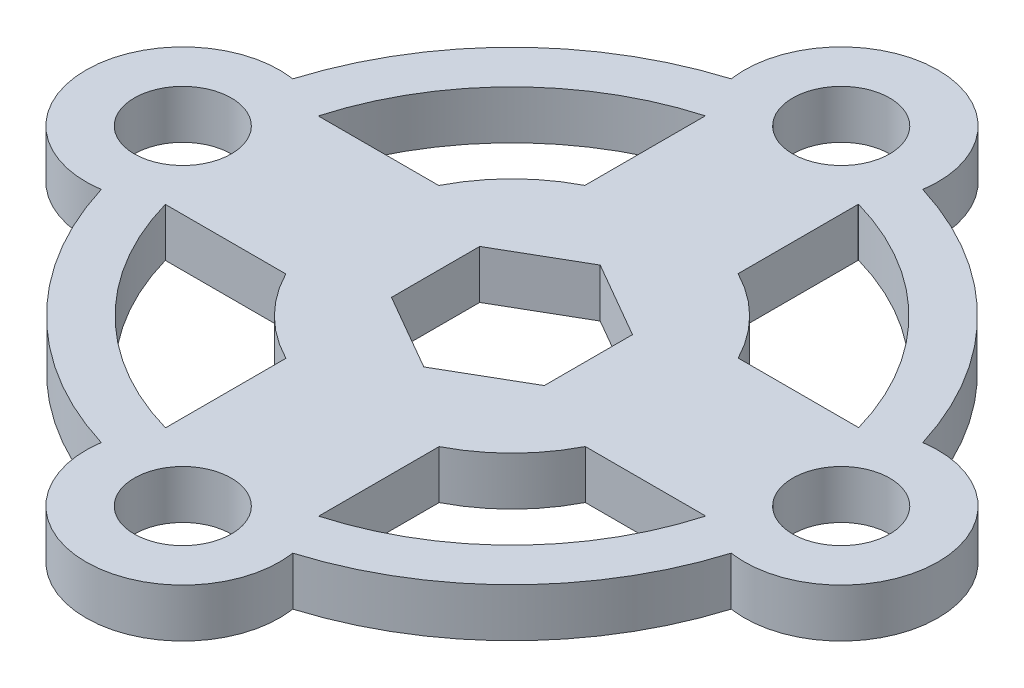
from build123d import *

# Parameters (mm, degrees)
SKETCH1_R           = 3.175
BOSS_EXTRUDE1_DEPTH = 3.175


with BuildPart() as part:
    # Sketch1 → Boss-Extrude1 (new body)
    with BuildSketch(Plane(origin=(0, 0, 0), x_dir=(1, 0, 0), z_dir=(0, 1, 0))):
        with BuildLine():
            ThreePointArc((-6.270051206, 20.615595113), (-15.236736921, 15.236736921), (-20.615595113, 6.270051206))
            ThreePointArc((-20.615595113, 6.270051206), (-27.887, 0), (-20.615595113, -6.270051206))
            ThreePointArc((-20.615595113, -6.270051206), (-15.236736921, -15.236736921), (-6.270051206, -20.615595113))
            ThreePointArc((-6.270051206, -20.615595113), (0, -27.887), (6.270051206, -20.615595113))
            ThreePointArc((6.270051206, -20.615595113), (15.236736921, -15.236736921), (20.615595113, -6.270051206))
            ThreePointArc((20.615595113, -6.270051206), (27.887, 0), (20.615595113, 6.270051206))
            ThreePointArc((20.615595113, 6.270051206), (15.236736921, 15.236736921), (6.270051206, 20.615595113))
            ThreePointArc((6.270051206, 20.615595113), (0, 27.887), (-6.270051206, 20.615595113))
        make_face()
        with BuildLine():
            Line((5, 9.797958971), (5, 17.651473213))
            ThreePointArc((5, 17.651473213), (5.008945556, 17.662979355), (5.017864634, 17.674506033))
            ThreePointArc((5.017864634, 17.674506033), (12.991672891, 12.991672891), (17.674506033, 5.017864634))
            Line((17.674506033, 5.017864634), (9.788821916, 5.017864634))
            ThreePointArc((9.788821916, 5.017864634), (7.771077074, 7.785265642), (5, 9.797958971))
        make_face(mode=Mode.SUBTRACT)
        with BuildLine():
            Line((-5.017864634, 17.674506033), (-5.017864634, 9.788821916))
            ThreePointArc((-5.017864634, 9.788821916), (-7.785265642, 7.771077074), (-9.797958971, 5))
            Line((-9.797958971, 5), (-17.651473213, 5))
            ThreePointArc((-17.651473213, 5), (-17.662979355, 5.008945556), (-17.674506033, 5.017864634))
            ThreePointArc((-17.674506033, 5.017864634), (-12.991672891, 12.991672891), (-5.017864634, 17.674506033))
        make_face(mode=Mode.SUBTRACT)
        with Locations((0, 21.548)):
            Circle(SKETCH1_R, mode=Mode.SUBTRACT)
        Polygon((0, 5.773502692), (5, 2.886751346), (5, -2.886751346), (0, -5.773502692), (-5, -2.886751346), (-5, 2.886751346), align=None, mode=Mode.SUBTRACT)
        with BuildLine():
            ThreePointArc((5.017864634, -9.788821916), (7.785265642, -7.771077074), (9.797958971, -5))
            Line((9.797958971, -5), (17.651473213, -5))
            ThreePointArc((17.651473213, -5), (17.662979355, -5.008945556), (17.674506033, -5.017864634))
            ThreePointArc((17.674506033, -5.017864634), (12.991672891, -12.991672891), (5.017864634, -17.674506033))
            Line((5.017864634, -17.674506033), (5.017864634, -9.788821916))
        make_face(mode=Mode.SUBTRACT)
        with BuildLine():
            ThreePointArc((-9.788821916, -5.017864634), (-7.771077074, -7.785265642), (-5, -9.797958971))
            Line((-5, -9.797958971), (-5, -17.651473213))
            ThreePointArc((-5, -17.651473213), (-5.008945556, -17.662979355), (-5.017864634, -17.674506033))
            ThreePointArc((-5.017864634, -17.674506033), (-12.991672891, -12.991672891), (-17.674506033, -5.017864634))
            Line((-17.674506033, -5.017864634), (-9.788821916, -5.017864634))
        make_face(mode=Mode.SUBTRACT)
        with Locations((-21.548, 0)):
            Circle(SKETCH1_R, mode=Mode.SUBTRACT)
        with Locations((21.548, 0)):
            Circle(SKETCH1_R, mode=Mode.SUBTRACT)
        with Locations((0, -21.548)):
            Circle(SKETCH1_R, mode=Mode.SUBTRACT)
    extrude(amount=BOSS_EXTRUDE1_DEPTH)


solid = part.part
